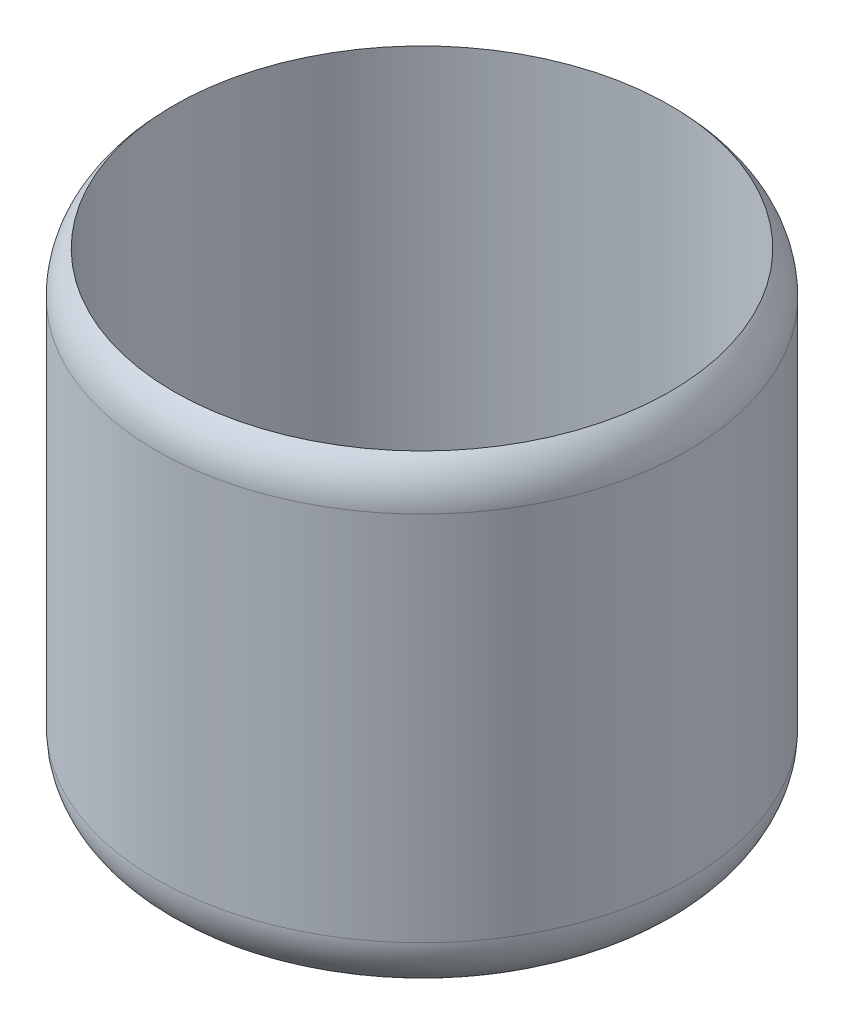
from build123d import *

# Parameters (mm, degrees)
BASE_R              = 22.5
BOSS_EXTRUDE1_DEPTH = 40
SKETCH2_R           = 21
CUT_EXTRUDE1_DEPTH  = 37
FILLET3_R           = 5


with BuildPart() as part:
    # Base → Boss-Extrude1 (new body)
    with BuildSketch(Plane(origin=(0, 0, 0), x_dir=(1, 0, 0), z_dir=(0, 1, 0))):
        with Locations(Location((0, 0, 0), (0, 0, 270))):
            Circle(BASE_R)
    extrude(amount=BOSS_EXTRUDE1_DEPTH)

    # Sketch2 → Cut-Extrude1 (cut)
    with BuildSketch(Plane(origin=(0, 40, 0), x_dir=(1, 0, 0), z_dir=(0, 1, 0))):
        with Locations(Location((0, 0, 0), (0, 0, 270))):
            Circle(SKETCH2_R)
    extrude(amount=-CUT_EXTRUDE1_DEPTH, mode=Mode.SUBTRACT)

    # Fillet3
    # the kernel refuses this fillet: 5 mm, written as the material it takes off along each edge
    with BuildSketch(Plane(origin=(0, 0, 0), x_dir=(0, 0, 1), z_dir=(-1, 0, 0))) as fillet3_piece_1:
        with BuildLine():
            CenterArc((22.5 - FILLET3_R, FILLET3_R), FILLET3_R, 270, 90)
            Line((22.5 - FILLET3_R, 0), (22.5 - FILLET3_R, -FILLET3_R * 0.02))
            Line((22.5 - FILLET3_R, -FILLET3_R * 0.02), (22.5 + FILLET3_R * 0.02, -FILLET3_R * 0.02))
            Line((22.5 + FILLET3_R * 0.02, -FILLET3_R * 0.02), (22.5 + FILLET3_R * 0.02, FILLET3_R))
            Line((22.5 + FILLET3_R * 0.02, FILLET3_R), (22.5, FILLET3_R))
        make_face()
    revolve(axis=Axis((0, 0, 0), (0, 1, 0)), mode=Mode.SUBTRACT)
    with BuildSketch(Plane(origin=(0, 40, 0), x_dir=(0, 0, 1), z_dir=(-1, 0, 0))) as fillet3_piece_2:
        with BuildLine():
            CenterArc((17.5, -3.570714214), FILLET3_R, 0, 45.572995999)
            Line((21, 0), (21.07, 0.071414284))
            ThreePointArc((21.07, 0.071414284), (21.75, 0.1), (22.5, 0.1))
            Line((22.5, 0.1), (22.6, 0))
            Line((22.6, 0), (22.6, -3.570714214))
            Line((22.6, -3.570714214), (22.5, -3.570714214))
        make_face()
    revolve(axis=Axis((0, 40, 0), (0, 1, 0)), mode=Mode.SUBTRACT)


solid = part.part
